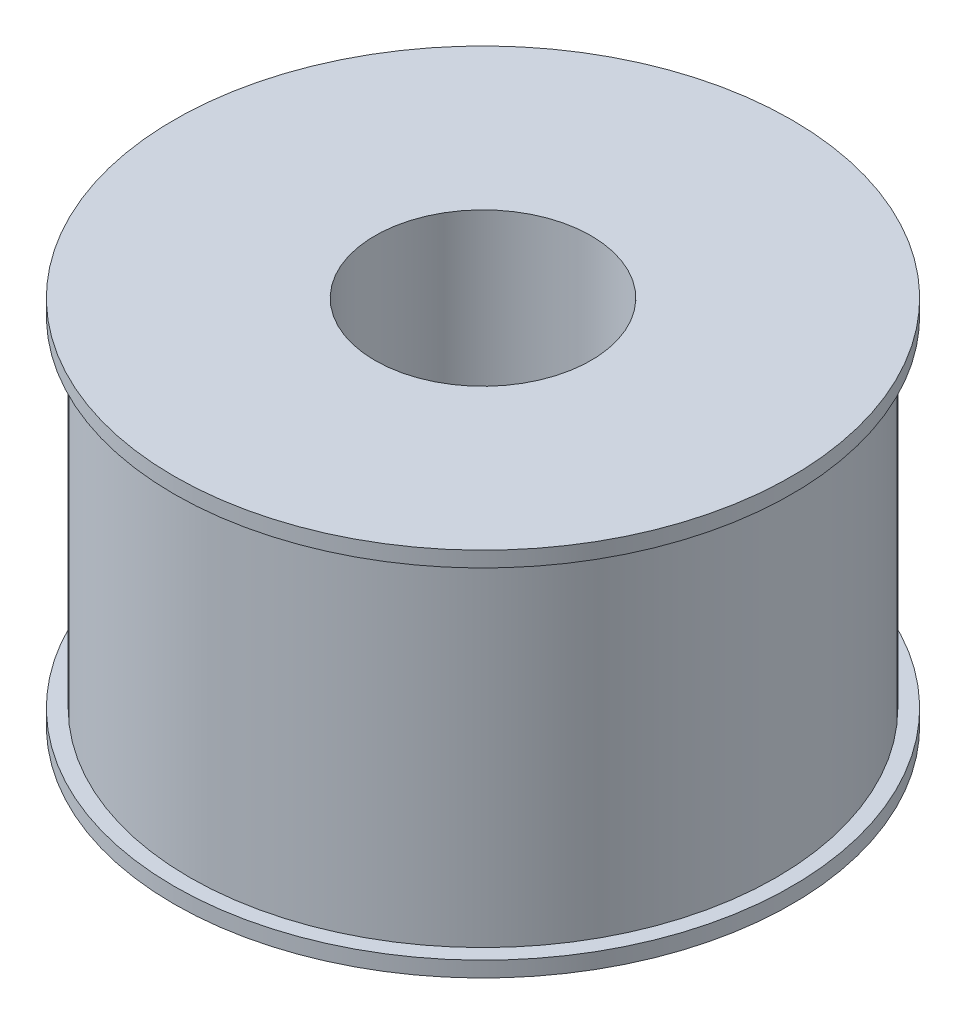
from build123d import *

# Parameters (mm, degrees)
SKETCH2_R           = 10
SKETCH2_R_2         = 3.5
BOSS_EXTRUDE1_DEPTH = 12
SKETCH3_W           = 1
SKETCH3_H           = 11


with BuildPart() as part:
    # Sketch2 → Boss-Extrude1 (new body)
    with BuildSketch(Plane(origin=(0, 0, 0), x_dir=(1, 0, 0), z_dir=(0, 1, 0))):
        Circle(SKETCH2_R)
        Circle(SKETCH2_R_2, mode=Mode.SUBTRACT)
    extrude(amount=BOSS_EXTRUDE1_DEPTH)

    # Sketch3 → Cut-Revolve1 (revolve, cut)
    with BuildSketch(Plane.XY):
        with Locations((-10, 6)):
            Rectangle(SKETCH3_W, SKETCH3_H)
    revolve(axis=Axis((0, 12, 0), (0, -1, 0)), mode=Mode.SUBTRACT)


solid = part.part
